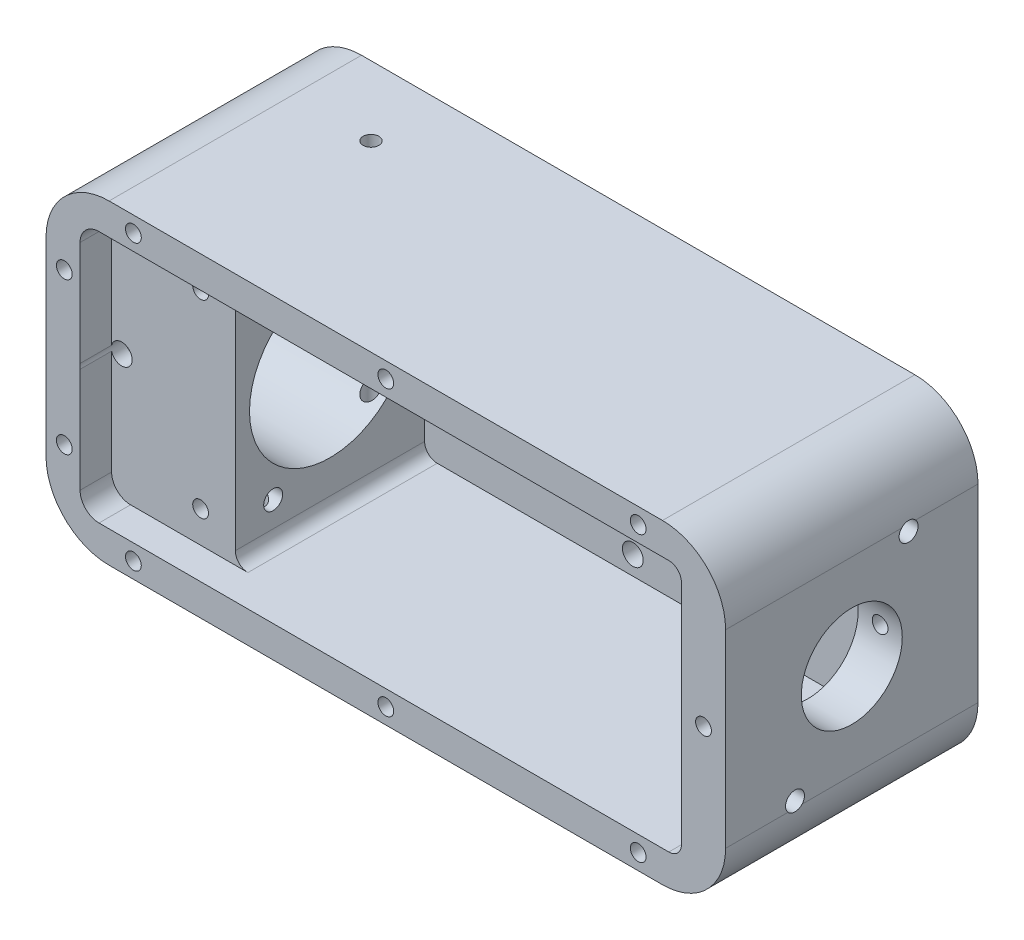
from build123d import *

# Parameters (mm, degrees)
SKETCH1_W                  = 107.7
SKETCH1_H                  = 50
BOSS_EXTRUDE1_DEPTH        = 40
SKETCH2_W                  = 75.7
SKETCH2_H                  = 40
CUT_EXTRUDE1_DEPTH         = 35
CUT_EXTRUDE2_REACH         = 125.791
SKETCH4_W                  = 19.6
SKETCH4_H                  = 40
SKETCH5_W                  = 45
SKETCH5_H                  = 10.3
CUT_EXTRUDE3_DEPTH         = 126.296807621
F_4_CLEARANCE_HOLE1_D      = 3.3
F_4_CLEARANCE_HOLE1_DEPTH  = 40
F_4_CLEARANCE_HOLE2_D      = 3.3
F_4_CLEARANCE_HOLE2_DEPTH  = 10
F_3_CLEARANCE_HOLE1_D      = 3
F_3_CLEARANCE_HOLE1_DEPTH  = 7
F_3_CLEARANCE_HOLE2_D      = 3
F_3_CLEARANCE_HOLE2_DEPTH  = 7
F_2_CLEARANCE_HOLE1_D      = 2.5
HOLE1_D                    = 16
HOLE1_DEPTH                = 7
F_2_CLEARANCE_HOLE2_D      = 2.5
F_2_CLEARANCE_HOLE2_DEPTH  = 52.098259685
F_3_CLEARANCE_HOLE3_D      = 3
F_3_CLEARANCE_HOLE3_DEPTH  = 107.7
F_2_CLEARANCE_HOLE3_D      = 2.5
F_2_CLEARANCE_HOLE3_DEPTH  = 10
F_2_CLEARANCE_HOLE4_REACH  = 127.297
F_2_CLEARANCE_HOLE4_BORE_R = 1.25
F_1_1_DIAMETER_HOLE1_D     = 25.4
F_1_1_DIAMETER_HOLE1_DEPTH = 25
SKETCH28_W                 = 1.65
SKETCH28_H                 = 40
F_2_CLEARANCE_HOLE5_D      = 2.5
F_2_CLEARANCE_HOLE5_DEPTH  = 10
FILLET1_R                  = 2
FILLET2_R                  = 3
FILLET3_R                  = 10
CUT_EXTRUDE_1_REACH        = 127.297
SKETCH_1_R                 = 12.75


with BuildPart() as part:
    # Sketch1 → Boss-Extrude1 (new body)
    with BuildSketch(Plane.XY.offset(40)):
        with Locations((53.85, -25)):
            Rectangle(SKETCH1_W, SKETCH1_H)
    extrude(amount=-BOSS_EXTRUDE1_DEPTH)

    # Sketch2 → Cut-Extrude1 (cut)
    with BuildSketch(Plane.XY.offset(40)):
        with Locations((62.85, -25)):
            Rectangle(SKETCH2_W, SKETCH2_H)
    extrude(amount=-CUT_EXTRUDE1_DEPTH, mode=Mode.SUBTRACT)

    # Sketch4 → Cut-Extrude2 (cut, up to next)
    with BuildSketch(Plane(origin=(0, 0, 35), x_dir=(-1, 0, 0), z_dir=(0, 0, -1)), mode=Mode.PRIVATE) as cut_extrude2_sk1:
        with Locations((-15.2, -25)):
            Rectangle(SKETCH4_W, SKETCH4_H)
    cut_extrude2_tool1 = extrude(cut_extrude2_sk1.sketch, amount=-CUT_EXTRUDE2_REACH, mode=Mode.PRIVATE) & part.part
    add(cut_extrude2_tool1.solids().sort_by_distance((15.2, -25, 35))[0], mode=Mode.SUBTRACT)

    # Sketch5 → Cut-Extrude3 (cut, through all)
    with BuildSketch(Plane(origin=(0, 0, 0), x_dir=(-1, 0, 0), z_dir=(0, 0, -1))):
        with Locations((-77.2, -25)):
            Rectangle(SKETCH5_W, SKETCH5_H)
    extrude(amount=-CUT_EXTRUDE3_DEPTH, mode=Mode.SUBTRACT)

    # #4 Clearance Hole1
    with Locations(Plane(origin=(0, 0, 0), x_dir=(-1, 0, 0), z_dir=(0, 0, -1))):
        with Locations((-58, -42), (-78, -42), (-98, -42), (-98, -8), (-58, -8), (-78, -8)):
            Hole(F_4_CLEARANCE_HOLE1_D / 2, depth=F_4_CLEARANCE_HOLE1_DEPTH)

    # #4 Clearance Hole2
    with Locations(Plane(origin=(0, 0, 0), x_dir=(-1, 0, 0), z_dir=(0, 0, -1))):
        with Locations((-8, -8)):
            Hole(F_4_CLEARANCE_HOLE2_D / 2, depth=F_4_CLEARANCE_HOLE2_DEPTH)

    # #3 Clearance Hole1
    with Locations(Plane(origin=(107.7, 0, 0), x_dir=(0, 0, -1), z_dir=(1, 0, 0))):
        with Locations((-29, -39)):
            Hole(F_3_CLEARANCE_HOLE1_D / 2, depth=F_3_CLEARANCE_HOLE1_DEPTH)

    # #3 Clearance Hole2
    with Locations(Plane.ZY.offset(-100.7)):
        with Locations((11, -11)):
            Hole(F_3_CLEARANCE_HOLE2_D / 2, depth=F_3_CLEARANCE_HOLE2_DEPTH)

    # #2 Clearance Hole1 (through all)
    with Locations(Plane(origin=(0, 0, 0), x_dir=(1, 0, 0), z_dir=(0, 1, 0))):
        with Locations((22.5, -11)):
            Hole(F_2_CLEARANCE_HOLE1_D / 2)

    # Hole1
    with Locations(Plane(origin=(107.7, 0, 0), x_dir=(0, 0, -1), z_dir=(1, 0, 0))):
        with Locations((-20, -25)):
            Hole(HOLE1_D / 2, depth=HOLE1_DEPTH)

    # #2 Clearance Hole2
    with Locations(Plane.XY.offset(40)):
        with Locations((104.2, -25)):
            Hole(F_2_CLEARANCE_HOLE2_D / 2, depth=F_2_CLEARANCE_HOLE2_DEPTH)

    # #3 Clearance Hole3
    with Locations(Plane.ZY):
        with Locations((29, -39), (11, -11)):
            Hole(F_3_CLEARANCE_HOLE3_D / 2, depth=F_3_CLEARANCE_HOLE3_DEPTH)

    # #2 Clearance Hole3
    with Locations(Plane.XY.offset(40)):
        with Locations((2.9, -37), (93.85, -2.5), (53.85, -2.5), (13.85, -2.5), (2.9, -13), (13.85, -47.5), (53.85, -47.5), (93.85, -47.5)):
            Hole(F_2_CLEARANCE_HOLE3_D / 2, depth=F_2_CLEARANCE_HOLE3_DEPTH)

    # #2 Clearance Hole4 bore → #2 Clearance Hole4 (cut, up to next)
    with BuildSketch(Plane(origin=(0, -50, 0), x_dir=(-1, 0, 0), z_dir=(0, -1, 0)), mode=Mode.PRIVATE) as f_2_clearance_hole4_sk1:
        with Locations((-22.5, -29)):
            Circle(F_2_CLEARANCE_HOLE4_BORE_R)
    f_2_clearance_hole4_tool1 = extrude(f_2_clearance_hole4_sk1.sketch, amount=-F_2_CLEARANCE_HOLE4_REACH, mode=Mode.PRIVATE) & part.part
    add(f_2_clearance_hole4_tool1.solids().sort_by_distance((22.5, -50, 29))[0], mode=Mode.SUBTRACT)

    # 1 (1) Diameter Hole1
    with Locations(Plane(origin=(25, 0, 0), x_dir=(0, 0, -1), z_dir=(1, 0, 0))):
        with Locations((-20, -25)):
            Hole(F_1_1_DIAMETER_HOLE1_D / 2, depth=F_1_1_DIAMETER_HOLE1_DEPTH)

    # Sketch28 → #4 Clearance Hole3 (revolve, cut)
    with BuildSketch(Plane(origin=(7, -25, 32.592358794), x_dir=(0, 1, 0), z_dir=(1, 0, 0))):
        with Locations((0.825, 20)):
            Rectangle(SKETCH28_W, SKETCH28_H)
    revolve(axis=Axis((7, -25, 26.242358794), (0, 0, 1)), mode=Mode.SUBTRACT)

    # #2 Clearance Hole5
    with Locations(Plane.XY.offset(35)):
        with Locations((19.5, -10), (19.5, -40)):
            Hole(F_2_CLEARANCE_HOLE5_D / 2, depth=F_2_CLEARANCE_HOLE5_DEPTH)

    # Fillet1
    fillet1_edges = [part.edges().sort_by_distance(p)[0] for p in [
        (100.7, -5, 22.5),
        (100.7, -45, 22.5),
        (25, -45, 20),
        (25, -5, 20),
        (99.7, -19.85, 2.5),
        (54.7, -19.85, 2.5),
        (54.7, -30.15, 2.5),
        (99.7, -30.15, 2.5),
    ]]
    fillet(fillet1_edges, radius=FILLET1_R)

    # Fillet2
    fillet2_edges = [part.edges().sort_by_distance(p)[0] for p in [
        (5.4, -5, 37.5),
        (5.4, -45, 37.5),
    ]]
    fillet(fillet2_edges, radius=FILLET2_R)

    # Fillet3
    # the kernel refuses this fillet: 10 mm, written as the material it takes off along each edge
    with BuildSketch(Plane(origin=(107.7, 0, 65), x_dir=(-1, 0, 0), z_dir=(0, 0, -1)), Plane(origin=(0, 0, 65), x_dir=(0, -1, 0), z_dir=(0, 0, -1))) as fillet3_piece_1:
        with BuildLine():
            CenterArc((FILLET3_R, -FILLET3_R), FILLET3_R, 90, 90)
            Line((0, -FILLET3_R), (0, 0))
            Line((0, 0), (FILLET3_R, 0))
        make_face()
    extrude(amount=90, mode=Mode.SUBTRACT)
    with BuildSketch(Plane(origin=(107.7, -50, 65), x_dir=(-1, 0, 0), z_dir=(0, 0, -1)), Plane(origin=(0, -50, 65), x_dir=(0, 1, 0), z_dir=(0, 0, -1))) as fillet3_piece_2:
        with BuildLine():
            CenterArc((FILLET3_R, FILLET3_R), FILLET3_R, 180, 90)
            Line((0, FILLET3_R), (0, 0))
            Line((0, 0), (FILLET3_R, 0))
        make_face()
    extrude(amount=90, mode=Mode.SUBTRACT)

    # 切除-拉伸1: up to this face of the body (flat: up to its plane)
    cut_extrude_1_end = Plane(part.part.faces().sort_by_distance((25, -25, 34.531385019))[0])
    # 草图1 → 切除-拉伸1 (cut, up to the picked face)
    with BuildSketch(Plane.ZY, mode=Mode.PRIVATE) as cut_extrude_1_sk1:
        with Locations((20, -25)):
            Circle(SKETCH_1_R)
    cut_extrude_1_tool1 = split(extrude(cut_extrude_1_sk1.sketch, amount=-CUT_EXTRUDE_1_REACH, mode=Mode.PRIVATE), bisect_by=cut_extrude_1_end, keep=Keep.BOTH, mode=Mode.PRIVATE)
    add(cut_extrude_1_tool1.solids().sort_by(Axis((0, -25, 20), (1, 0, 0)))[0], mode=Mode.SUBTRACT)


solid = part.part
